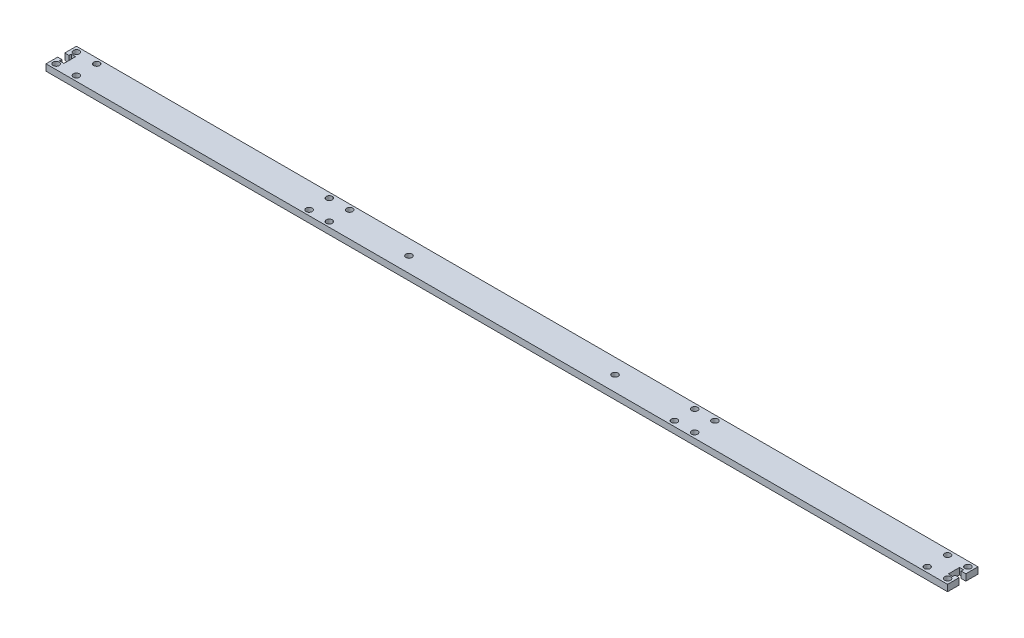
from build123d import *

# Parameters (mm, degrees)
SKETCH1_R           = 1.5
BOSS_EXTRUDE1_DEPTH = 3.175
CUT_EXTRUDE2_DEPTH  = 10
SKETCH6_W           = 2.65
SKETCH6_H           = 3.175
CUT_EXTRUDE3_DEPTH  = 0.25


with BuildPart() as part:
    # Sketch1 → Boss-Extrude1 (new body)
    with BuildSketch(Plane(origin=(0, 0, 0), x_dir=(1, 0, 0), z_dir=(0, 1, 0))):
        Polygon((0, 7.5), (0, 0), (444.5, 0), (444.5, 15), (0, 15), align=None)
        with Locations((2.5, 2.5)):
            Circle(SKETCH1_R, mode=Mode.SUBTRACT)
        with Locations((12.5, 2.5)):
            Circle(SKETCH1_R, mode=Mode.SUBTRACT)
        with Locations((2.5, 12.5)):
            Circle(SKETCH1_R, mode=Mode.SUBTRACT)
        with Locations((12.5, 12.5)):
            Circle(SKETCH1_R, mode=Mode.SUBTRACT)
        with Locations((127.2, 2.5)):
            Circle(SKETCH1_R, mode=Mode.SUBTRACT)
        with Locations((137.2, 2.5)):
            Circle(SKETCH1_R, mode=Mode.SUBTRACT)
        with Locations((127.2, 12.5)):
            Circle(SKETCH1_R, mode=Mode.SUBTRACT)
        with Locations((137.2, 12.5)):
            Circle(SKETCH1_R, mode=Mode.SUBTRACT)
        with Locations((171.45, 7.5)):
            Circle(SKETCH1_R, mode=Mode.SUBTRACT)
        with Locations((273.05, 7.5)):
            Circle(SKETCH1_R, mode=Mode.SUBTRACT)
        with Locations((442, 12.5)):
            Circle(SKETCH1_R, mode=Mode.SUBTRACT)
        with Locations((307.3, 2.5)):
            Circle(SKETCH1_R, mode=Mode.SUBTRACT)
        with Locations((317.3, 2.5)):
            Circle(SKETCH1_R, mode=Mode.SUBTRACT)
        with Locations((432, 2.5)):
            Circle(SKETCH1_R, mode=Mode.SUBTRACT)
        with Locations((442, 2.5)):
            Circle(SKETCH1_R, mode=Mode.SUBTRACT)
        with Locations((307.3, 12.5)):
            Circle(SKETCH1_R, mode=Mode.SUBTRACT)
        with Locations((317.3, 12.5)):
            Circle(SKETCH1_R, mode=Mode.SUBTRACT)
        with Locations((432, 12.5)):
            Circle(SKETCH1_R, mode=Mode.SUBTRACT)
    extrude(amount=BOSS_EXTRUDE1_DEPTH)

    # Sketch4 → Cut-Extrude2 (cut)
    with BuildSketch(Plane(origin=(0, 3.175, 0), x_dir=(1, 0, 0), z_dir=(0, 1, 0))):
        Polygon((444.5, 5.75), (444.5, 9), (442.2, 9), (442.2, 10.15), (440.5, 10.15), (440.5, 7.5), (440.25, 7.5), (440.25, 4.6), (442.45, 4.6), (442.45, 5.75), align=None)
        Polygon((2.05, 9.25), (0, 9.25), (0, 5.75), (2.05, 5.75), (2.05, 4.6), (4.25, 4.6), (4.25, 10.4), (2.05, 10.4), align=None)
    extrude(amount=-CUT_EXTRUDE2_DEPTH, mode=Mode.SUBTRACT)

    # Sketch6 → Cut-Extrude3 (cut)
    with BuildSketch(Plane(origin=(440.5, 0, 0), x_dir=(0, 0, -1), z_dir=(1, 0, 0))):
        with Locations((8.825, 1.5875)):
            Rectangle(SKETCH6_W, SKETCH6_H)
    extrude(amount=-CUT_EXTRUDE3_DEPTH, mode=Mode.SUBTRACT)


solid = part.part
